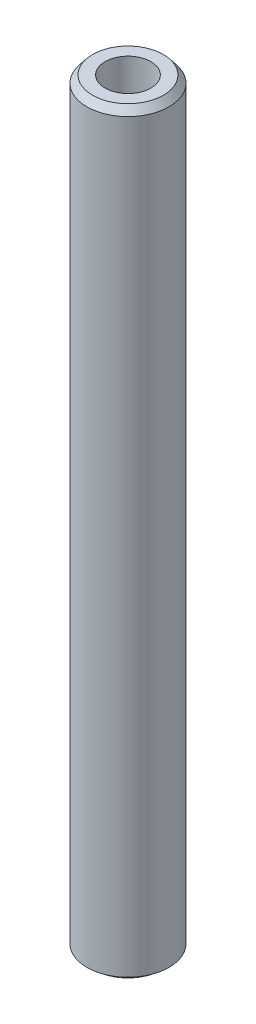
from build123d import *
from OCP.BRepFilletAPI import BRepFilletAPI_MakeChamfer

# Parameters (mm, degrees)
SKETCH1_R           = 32.5
BOSS_EXTRUDE1_DEPTH = 600
SKETCH2_R           = 18.143603034
CUT_EXTRUDE1_DEPTH  = 602.757841661
CHAMFER1_SIZE       = 5.653652915
CHAMFER1_SIZE2      = 4.522507525


with BuildPart() as part:
    # Sketch1 → Boss-Extrude1 (new body)
    with BuildSketch(Plane(origin=(0, 0, 0), x_dir=(1, 0, 0), z_dir=(0, 1, 0))):
        Circle(SKETCH1_R)
    extrude(amount=BOSS_EXTRUDE1_DEPTH)

    # Sketch2 → Cut-Extrude1 (cut, through all)
    with BuildSketch(Plane(origin=(0, 0, 0), x_dir=(1, 0, 0), z_dir=(0, 1, 0))):
        Circle(SKETCH2_R)
    extrude(amount=CUT_EXTRUDE1_DEPTH, mode=Mode.SUBTRACT)

    # Chamfer1: one chamfer whose edges measure the first distance from different faces: ONE call of the kernel's chamfer builder (chamfer() names one face for all edges)
    chamfer1_edges_1 = [part.edges().sort_by_distance(p)[0] for p in [
        (-32.5, 600, 0),
    ]]
    chamfer1_side_1 = [part.faces().sort_by_distance(p)[0] for p in [
        (-32.5, 300, 0),
    ]]
    chamfer1_edges_2 = [part.edges().sort_by_distance(p)[0] for p in [
        (-32.5, 0, 0),
    ]]
    chamfer1_side_2 = [part.faces().sort_by_distance(p)[0] for p in [
        (-31.580761184, 0, 0),
    ]]
    chamfer1 = BRepFilletAPI_MakeChamfer(part.part.solid().wrapped)
    for e in chamfer1_edges_1:
        chamfer1.Add(CHAMFER1_SIZE, CHAMFER1_SIZE2, e.wrapped, chamfer1_side_1[0].wrapped)  # the first distance lies on this face
    for e in chamfer1_edges_2:
        chamfer1.Add(CHAMFER1_SIZE, CHAMFER1_SIZE2, e.wrapped, chamfer1_side_2[0].wrapped)  # the first distance lies on this face
    add(Compound.cast(chamfer1.Shape()), mode=Mode.REPLACE)


solid = part.part
